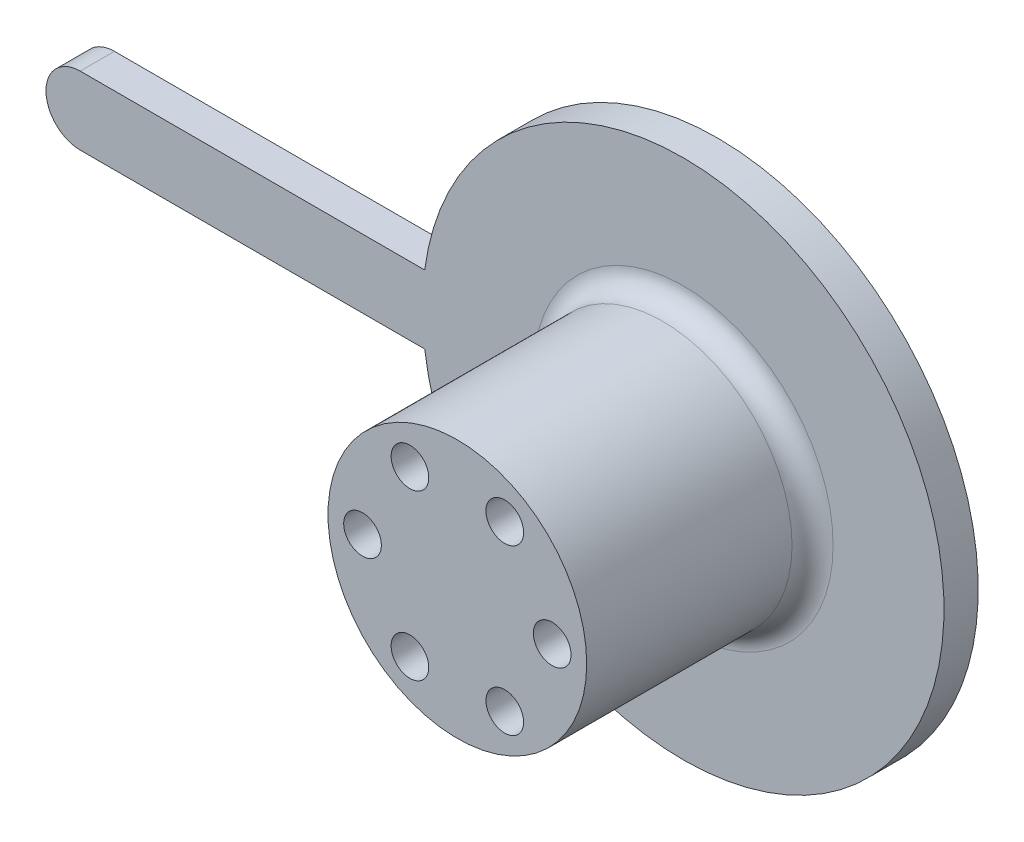
from build123d import *

# Parameters (mm, degrees)
BOSS_EXTRUDE3_DEPTH = 5
SKETCH5_R           = 18.9
BOSS_EXTRUDE4_DEPTH = 33
FILLET4_R           = 3
SKETCH6_R           = 2.75
CUT_EXTRUDE4_DEPTH  = 39.48


with BuildPart() as part:
    # Sketch4 → Boss-Extrude3 (new body)
    with BuildSketch(Plane.XY):
        with BuildLine():
            Line((-88.1, -5), (-37.770491127, -5))
            ThreePointArc((-37.770491127, -5), (38.1, 0), (-37.770491127, 5))
            Line((-37.770491127, 5), (-88.1, 5))
            ThreePointArc((-88.1, 5), (-93.1, 0), (-88.1, -5))
        make_face()
    extrude(amount=BOSS_EXTRUDE3_DEPTH)

    # Sketch5 → Boss-Extrude4 (add)
    with BuildSketch(Plane.XY.offset(5)):
        Circle(SKETCH5_R)
    extrude(amount=BOSS_EXTRUDE4_DEPTH)

    # Fillet4
    fillet4_edges = [part.edges().sort_by_distance(p)[0] for p in [
        (-18.9, 0, 5),
    ]]
    fillet(fillet4_edges, radius=FILLET4_R)

    # Sketch6 → Cut-Extrude4 (cut)
    with BuildSketch(Plane.XY.offset(38)):
        with Locations((-13.856406461, 0)):
            Circle(SKETCH6_R)
        with Locations((-6.92820323, -12)):
            Circle(SKETCH6_R)
        with Locations((-6.92820323, 12)):
            Circle(SKETCH6_R)
        with Locations((6.92820323, -12)):
            Circle(SKETCH6_R)
        with Locations((6.92820323, 12)):
            Circle(SKETCH6_R)
        with Locations((13.856406461, 0)):
            Circle(SKETCH6_R)
    extrude(amount=-CUT_EXTRUDE4_DEPTH, mode=Mode.SUBTRACT)


solid = part.part
